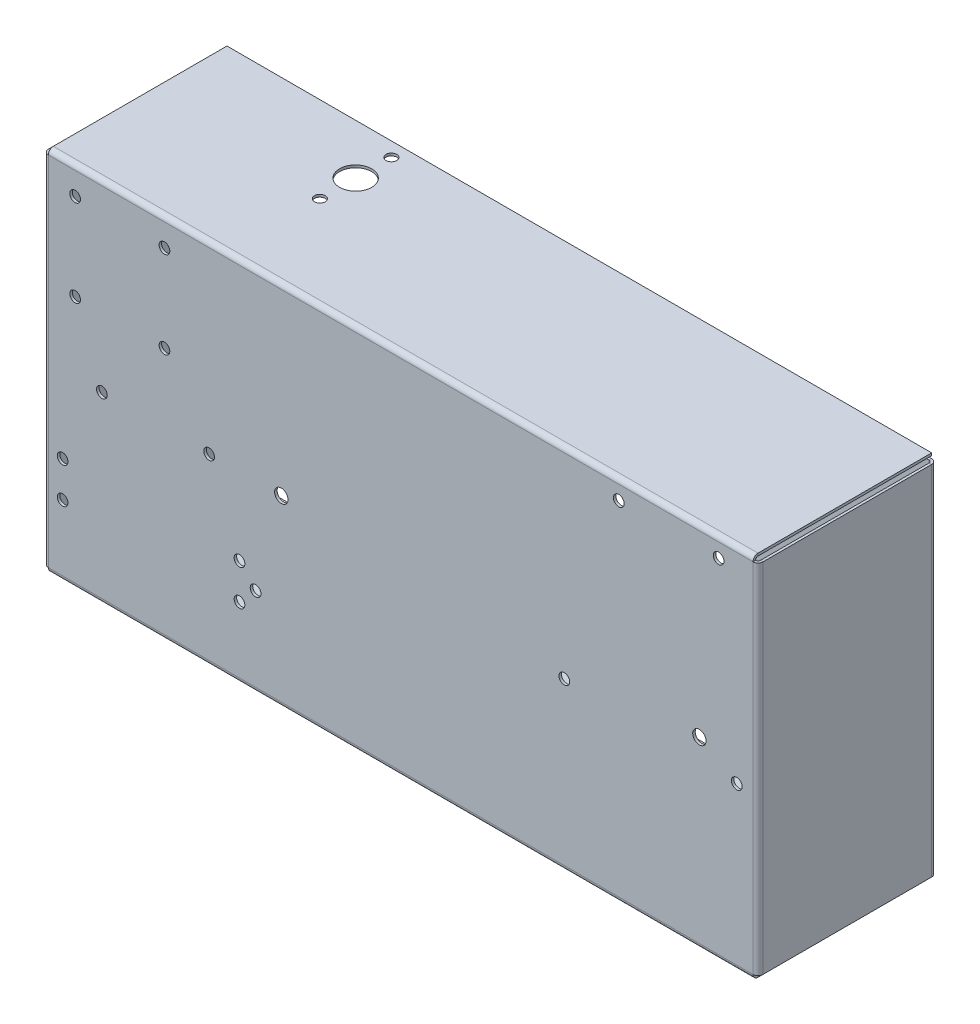
from build123d import *

# Parameters (mm, degrees)
BASE_FLANGE1_DEPTH = 100
EDGE_FLANGE1_DEPTH = 197.2
EDGE_FLANGE2_DEPTH = 197.2
HOLE1_START        = -1.4
HOLE1_OUTLINE_R    = 4.5
HOLE1_OUTLINE_R_2  = 1.5
HOLE1_DEPTH        = 102.8
CUT_EXTRUDE2_REACH = 231.743
SKETCH20_R         = 1.21
CUT_EXTRUDE3_REACH = 231.743
SKETCH22_R         = 1.5
SKETCH22_R_2       = 1.87
CUT_EXTRUDE5_REACH = 231.743
SKETCH26_R         = 1.5
CUT_EXTRUDE6_REACH = 231.743
SKETCH27_R         = 1.5
CUT_EXTRUDE7_REACH = 231.743
SKETCH28_R         = 1.5


# Read off the part's stored shape, not the designer's step: Hole1
# Sheet-metal steps are written as plain solids
with BuildPart() as part:
    # Sketch1 → Base-Flange1 (new body)
    with BuildSketch(Plane(origin=(0, 0, 0), x_dir=(1, 0, 0), z_dir=(0, 1, 0))):
        with BuildLine():
            Line((0, 50), (0, 1.4))
            ThreePointArc((0, 1.4), (0.410050506, 0.410050506), (1.4, 0))
            Line((1.4, 0), (198.6, 0))
            ThreePointArc((198.6, 0), (199.589949494, 0.410050506), (200, 1.4))
            Line((200, 1.4), (200, 48.6))
            ThreePointArc((200, 48.6), (199.589949494, 49.589949494), (198.6, 50))
            Line((198.6, 50), (145, 50))
            Line((145, 50), (145, 49.3))
            Line((145, 49.3), (198.6, 49.3))
            ThreePointArc((198.6, 49.3), (199.094974747, 49.094974747), (199.3, 48.6))
            Line((199.3, 48.6), (199.3, 1.4))
            ThreePointArc((199.3, 1.4), (199.094974747, 0.905025253), (198.6, 0.7))
            Line((198.6, 0.7), (1.4, 0.7))
            ThreePointArc((1.4, 0.7), (0.905025253, 0.905025253), (0.7, 1.4))
            Line((0.7, 1.4), (0.7, 50))
            Line((0.7, 50), (0, 50))
        make_face()
    extrude(amount=BASE_FLANGE1_DEPTH)

    # Edge-Flange1 section (across the edge) → Edge-Flange1 (add)
    with BuildSketch(Plane(origin=(198.6, -0.7, -0.7), x_dir=(0, 1, 0), z_dir=(-1, 0, 0))):
        with BuildLine():
            Line((-0.7, 0.7), (-0.7, 49.3))
            Line((-0.7, 49.3), (0, 49.3))
            Line((0, 49.3), (0, 0.7))
            ThreePointArc((0, 0.7), (0.205025253, 0.205025253), (0.7, 0))
            Line((0.7, 0), (0.7, -0.7))
            ThreePointArc((0.7, -0.7), (-0.289949494, -0.289949494), (-0.7, 0.7))
        make_face()
    extrude(amount=EDGE_FLANGE1_DEPTH)

    # Edge-Flange2 section (across the edge) → Edge-Flange2 (add)
    with BuildSketch(Plane(origin=(1.4, 100.7, -0.7), x_dir=(0, -1, 0), z_dir=(1, 0, 0))):
        with BuildLine():
            Line((-0.7, 0.7), (-0.7, 49.3))
            Line((-0.7, 49.3), (0, 49.3))
            Line((0, 49.3), (0, 0.7))
            ThreePointArc((0, 0.7), (0.205025253, 0.205025253), (0.7, 0))
            Line((0.7, 0), (0.7, -0.7))
            ThreePointArc((0.7, -0.7), (-0.289949494, -0.289949494), (-0.7, 0.7))
        make_face()
    extrude(amount=EDGE_FLANGE2_DEPTH)

    # Hole1 outline → Hole1 (cut)
    with BuildSketch(Plane(origin=(0, 0, 0), x_dir=(1, 0, 0), z_dir=(0, 1, 0)).offset(HOLE1_START)):
        with Locations((51.4, 36)):
            Circle(HOLE1_OUTLINE_R)
        with Locations((51.4, 26)):
            Circle(HOLE1_OUTLINE_R_2)
        with Locations((51.4, 46)):
            Circle(HOLE1_OUTLINE_R_2)
    extrude(amount=HOLE1_DEPTH, mode=Mode.SUBTRACT)

    # Sketch20 → Cut-Extrude2 (cut, up to next)
    with BuildSketch(Plane(origin=(0, 0, -50), x_dir=(-1, 0, 0), z_dir=(0, 0, -1)), mode=Mode.PRIVATE) as cut_extrude2_sk1:
        with Locations((-160, 57.75)):
            Circle(SKETCH20_R)
    cut_extrude2_tool1 = extrude(cut_extrude2_sk1.sketch, amount=-CUT_EXTRUDE2_REACH, mode=Mode.PRIVATE) & part.part
    # Sketch20 → Cut-Extrude2 (cut, up to next)
    with BuildSketch(Plane(origin=(0, 0, -50), x_dir=(-1, 0, 0), z_dir=(0, 0, -1)), mode=Mode.PRIVATE) as cut_extrude2_sk2:
        with Locations((-160, 42.25)):
            Circle(SKETCH20_R)
    cut_extrude2_tool2 = extrude(cut_extrude2_sk2.sketch, amount=-CUT_EXTRUDE2_REACH, mode=Mode.PRIVATE) & part.part
    add(cut_extrude2_tool1.solids().sort_by_distance((160, 57.75, -50))[0], mode=Mode.SUBTRACT)
    add(cut_extrude2_tool2.solids().sort_by_distance((160, 42.25, -50))[0], mode=Mode.SUBTRACT)

    # Sketch22 → Cut-Extrude3 (cut, up to next)
    with BuildSketch(Plane.XY, mode=Mode.PRIVATE) as cut_extrude3_sk1:
        with Locations((16.4, 50)):
            Circle(SKETCH22_R)
    cut_extrude3_tool1 = extrude(cut_extrude3_sk1.sketch, amount=-CUT_EXTRUDE3_REACH, mode=Mode.PRIVATE) & part.part
    # Sketch22 → Cut-Extrude3 (cut, up to next)
    with BuildSketch(Plane.XY, mode=Mode.PRIVATE) as cut_extrude3_sk2:
        with Locations((46.4, 50)):
            Circle(SKETCH22_R)
    cut_extrude3_tool2 = extrude(cut_extrude3_sk2.sketch, amount=-CUT_EXTRUDE3_REACH, mode=Mode.PRIVATE) & part.part
    # Sketch22 → Cut-Extrude3 (cut, up to next)
    with BuildSketch(Plane.XY, mode=Mode.PRIVATE) as cut_extrude3_sk3:
        with Locations((66.6, 50)):
            Circle(SKETCH22_R_2)
    cut_extrude3_tool3 = extrude(cut_extrude3_sk3.sketch, amount=-CUT_EXTRUDE3_REACH, mode=Mode.PRIVATE) & part.part
    # Sketch22 → Cut-Extrude3 (cut, up to next)
    with BuildSketch(Plane.XY, mode=Mode.PRIVATE) as cut_extrude3_sk4:
        with Locations((183.6, 50)):
            Circle(SKETCH22_R_2)
    cut_extrude3_tool4 = extrude(cut_extrude3_sk4.sketch, amount=-CUT_EXTRUDE3_REACH, mode=Mode.PRIVATE) & part.part
    add(cut_extrude3_tool1.solids().sort_by_distance((16.4, 50, 0))[0], mode=Mode.SUBTRACT)
    add(cut_extrude3_tool2.solids().sort_by_distance((46.4, 50, 0))[0], mode=Mode.SUBTRACT)
    add(cut_extrude3_tool3.solids().sort_by_distance((66.6, 50, 0))[0], mode=Mode.SUBTRACT)
    add(cut_extrude3_tool4.solids().sort_by_distance((183.6, 50, 0))[0], mode=Mode.SUBTRACT)

    # Sketch26 → Cut-Extrude5 (cut, up to next)
    with BuildSketch(Plane.XY, mode=Mode.PRIVATE) as cut_extrude5_sk1:
        with Locations((5.4, 28.4)):
            Circle(SKETCH26_R)
    cut_extrude5_tool1 = extrude(cut_extrude5_sk1.sketch, amount=-CUT_EXTRUDE5_REACH, mode=Mode.PRIVATE) & part.part
    # Sketch26 → Cut-Extrude5 (cut, up to next)
    with BuildSketch(Plane.XY, mode=Mode.PRIVATE) as cut_extrude5_sk2:
        with Locations((54.9, 28.4)):
            Circle(SKETCH26_R)
    cut_extrude5_tool2 = extrude(cut_extrude5_sk2.sketch, amount=-CUT_EXTRUDE5_REACH, mode=Mode.PRIVATE) & part.part
    # Sketch26 → Cut-Extrude5 (cut, up to next)
    with BuildSketch(Plane.XY, mode=Mode.PRIVATE) as cut_extrude5_sk3:
        with Locations((54.9, 18.4)):
            Circle(SKETCH26_R)
    cut_extrude5_tool3 = extrude(cut_extrude5_sk3.sketch, amount=-CUT_EXTRUDE5_REACH, mode=Mode.PRIVATE) & part.part
    # Sketch26 → Cut-Extrude5 (cut, up to next)
    with BuildSketch(Plane.XY, mode=Mode.PRIVATE) as cut_extrude5_sk4:
        with Locations((5.4, 18.4)):
            Circle(SKETCH26_R)
    cut_extrude5_tool4 = extrude(cut_extrude5_sk4.sketch, amount=-CUT_EXTRUDE5_REACH, mode=Mode.PRIVATE) & part.part
    # Sketch26 → Cut-Extrude5 (cut, up to next)
    with BuildSketch(Plane.XY, mode=Mode.PRIVATE) as cut_extrude5_sk5:
        with Locations((59.4, 23.4)):
            Circle(SKETCH26_R)
    cut_extrude5_tool5 = extrude(cut_extrude5_sk5.sketch, amount=-CUT_EXTRUDE5_REACH, mode=Mode.PRIVATE) & part.part
    add(cut_extrude5_tool1.solids().sort_by_distance((5.4, 28.4, 0))[0], mode=Mode.SUBTRACT)
    add(cut_extrude5_tool2.solids().sort_by_distance((54.9, 28.4, 0))[0], mode=Mode.SUBTRACT)
    add(cut_extrude5_tool3.solids().sort_by_distance((54.9, 18.4, 0))[0], mode=Mode.SUBTRACT)
    add(cut_extrude5_tool4.solids().sort_by_distance((5.4, 18.4, 0))[0], mode=Mode.SUBTRACT)
    add(cut_extrude5_tool5.solids().sort_by_distance((59.4, 23.4, 0))[0], mode=Mode.SUBTRACT)

    # Sketch27 → Cut-Extrude6 (cut, up to next)
    with BuildSketch(Plane.XY, mode=Mode.PRIVATE) as cut_extrude6_sk1:
        with Locations((8.9, 93.7)):
            Circle(SKETCH27_R)
    cut_extrude6_tool1 = extrude(cut_extrude6_sk1.sketch, amount=-CUT_EXTRUDE6_REACH, mode=Mode.PRIVATE) & part.part
    # Sketch27 → Cut-Extrude6 (cut, up to next)
    with BuildSketch(Plane.XY, mode=Mode.PRIVATE) as cut_extrude6_sk2:
        with Locations((8.9, 69.4)):
            Circle(SKETCH27_R)
    cut_extrude6_tool2 = extrude(cut_extrude6_sk2.sketch, amount=-CUT_EXTRUDE6_REACH, mode=Mode.PRIVATE) & part.part
    # Sketch27 → Cut-Extrude6 (cut, up to next)
    with BuildSketch(Plane.XY, mode=Mode.PRIVATE) as cut_extrude6_sk3:
        with Locations((33.9, 93.7)):
            Circle(SKETCH27_R)
    cut_extrude6_tool3 = extrude(cut_extrude6_sk3.sketch, amount=-CUT_EXTRUDE6_REACH, mode=Mode.PRIVATE) & part.part
    # Sketch27 → Cut-Extrude6 (cut, up to next)
    with BuildSketch(Plane.XY, mode=Mode.PRIVATE) as cut_extrude6_sk4:
        with Locations((33.9, 69.4)):
            Circle(SKETCH27_R)
    cut_extrude6_tool4 = extrude(cut_extrude6_sk4.sketch, amount=-CUT_EXTRUDE6_REACH, mode=Mode.PRIVATE) & part.part
    add(cut_extrude6_tool1.solids().sort_by_distance((8.9, 93.7, 0))[0], mode=Mode.SUBTRACT)
    add(cut_extrude6_tool2.solids().sort_by_distance((8.9, 69.4, 0))[0], mode=Mode.SUBTRACT)
    add(cut_extrude6_tool3.solids().sort_by_distance((33.9, 93.7, 0))[0], mode=Mode.SUBTRACT)
    add(cut_extrude6_tool4.solids().sort_by_distance((33.9, 69.4, 0))[0], mode=Mode.SUBTRACT)

    # Sketch28 → Cut-Extrude7 (cut, up to next)
    with BuildSketch(Plane.XY, mode=Mode.PRIVATE) as cut_extrude7_sk1:
        with Locations((194.06, 43.97)):
            Circle(SKETCH28_R)
    cut_extrude7_tool1 = extrude(cut_extrude7_sk1.sketch, amount=-CUT_EXTRUDE7_REACH, mode=Mode.PRIVATE) & part.part
    # Sketch28 → Cut-Extrude7 (cut, up to next)
    with BuildSketch(Plane.XY, mode=Mode.PRIVATE) as cut_extrude7_sk2:
        with Locations((145.8, 45.24)):
            Circle(SKETCH28_R)
    cut_extrude7_tool2 = extrude(cut_extrude7_sk2.sketch, amount=-CUT_EXTRUDE7_REACH, mode=Mode.PRIVATE) & part.part
    # Sketch28 → Cut-Extrude7 (cut, up to next)
    with BuildSketch(Plane.XY, mode=Mode.PRIVATE) as cut_extrude7_sk3:
        with Locations((161.04, 96.04)):
            Circle(SKETCH28_R)
    cut_extrude7_tool3 = extrude(cut_extrude7_sk3.sketch, amount=-CUT_EXTRUDE7_REACH, mode=Mode.PRIVATE) & part.part
    # Sketch28 → Cut-Extrude7 (cut, up to next)
    with BuildSketch(Plane.XY, mode=Mode.PRIVATE) as cut_extrude7_sk4:
        with Locations((188.98, 96.04)):
            Circle(SKETCH28_R)
    cut_extrude7_tool4 = extrude(cut_extrude7_sk4.sketch, amount=-CUT_EXTRUDE7_REACH, mode=Mode.PRIVATE) & part.part
    add(cut_extrude7_tool1.solids().sort_by_distance((194.06, 43.97, 0))[0], mode=Mode.SUBTRACT)
    add(cut_extrude7_tool2.solids().sort_by_distance((145.8, 45.24, 0))[0], mode=Mode.SUBTRACT)
    add(cut_extrude7_tool3.solids().sort_by_distance((161.04, 96.04, 0))[0], mode=Mode.SUBTRACT)
    add(cut_extrude7_tool4.solids().sort_by_distance((188.98, 96.04, 0))[0], mode=Mode.SUBTRACT)


solid = part.part
